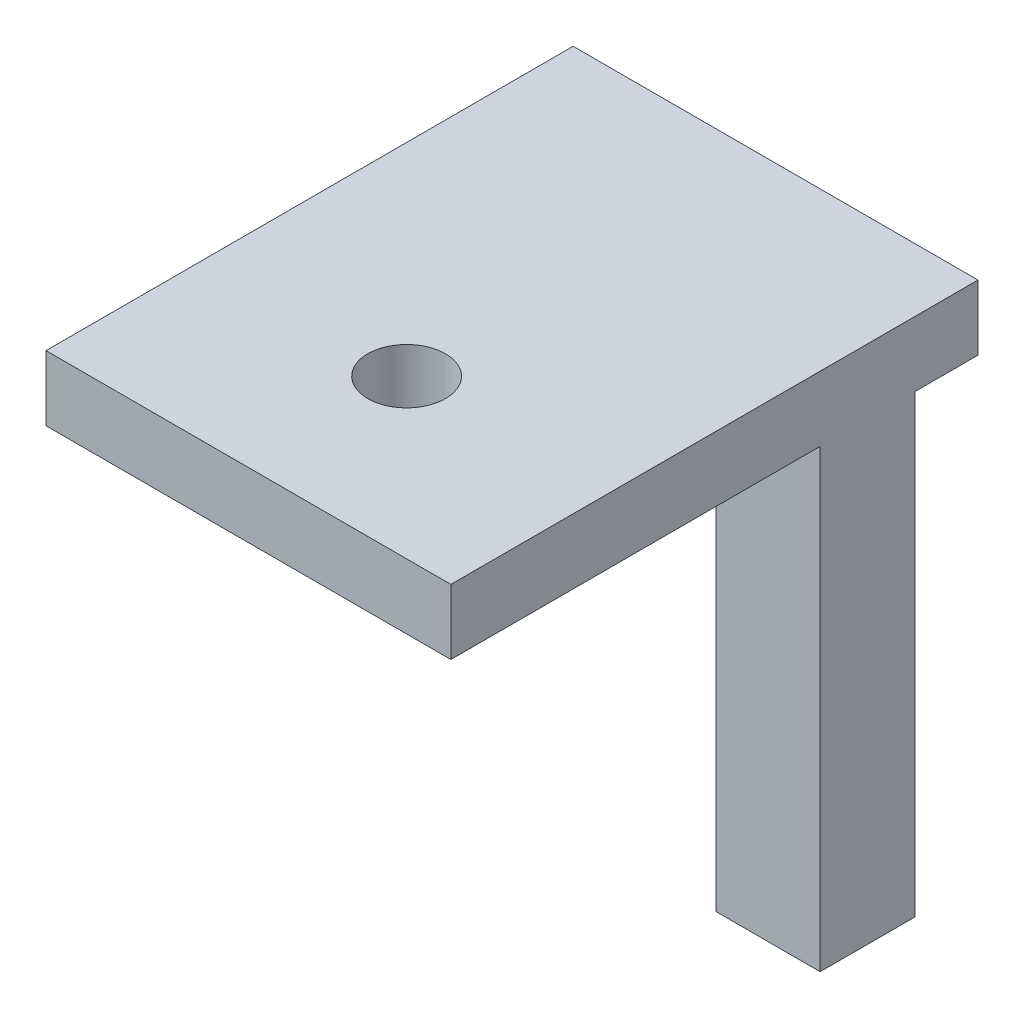
from build123d import *

# Parameters (mm, degrees)
SKETCH1_W           = 62.2
SKETCH1_H           = 80.98413
BOSS_EXTRUDE1_DEPTH = 10
SKETCH2_R           = 5.969
CUT_EXTRUDE1_DEPTH  = 10
SKETCH3_W           = 16
SKETCH3_H           = 14.55264
BOSS_EXTRUDE2_DEPTH = 69.9


with BuildPart() as part:
    # Sketch1 → Boss-Extrude1 (new body)
    with BuildSketch(Plane(origin=(0, 0, 0), x_dir=(1, 0, 0), z_dir=(0, 1, 0))):
        Rectangle(SKETCH1_W, SKETCH1_H)
    extrude(amount=BOSS_EXTRUDE1_DEPTH)

    # Sketch2 → Cut-Extrude1 (cut)
    with BuildSketch(Plane(origin=(0, 10, 0), x_dir=(1, 0, 0), z_dir=(0, 1, 0))):
        with Locations((0, -16.192065)):
            Circle(SKETCH2_R)
    extrude(amount=-CUT_EXTRUDE1_DEPTH, mode=Mode.SUBTRACT)

    # Sketch3 → Boss-Extrude2 (add)
    with BuildSketch(Plane.XZ):
        with Locations((23.1, -23.515745)):
            Rectangle(SKETCH3_W, SKETCH3_H)
    extrude(amount=BOSS_EXTRUDE2_DEPTH)


solid = part.part
